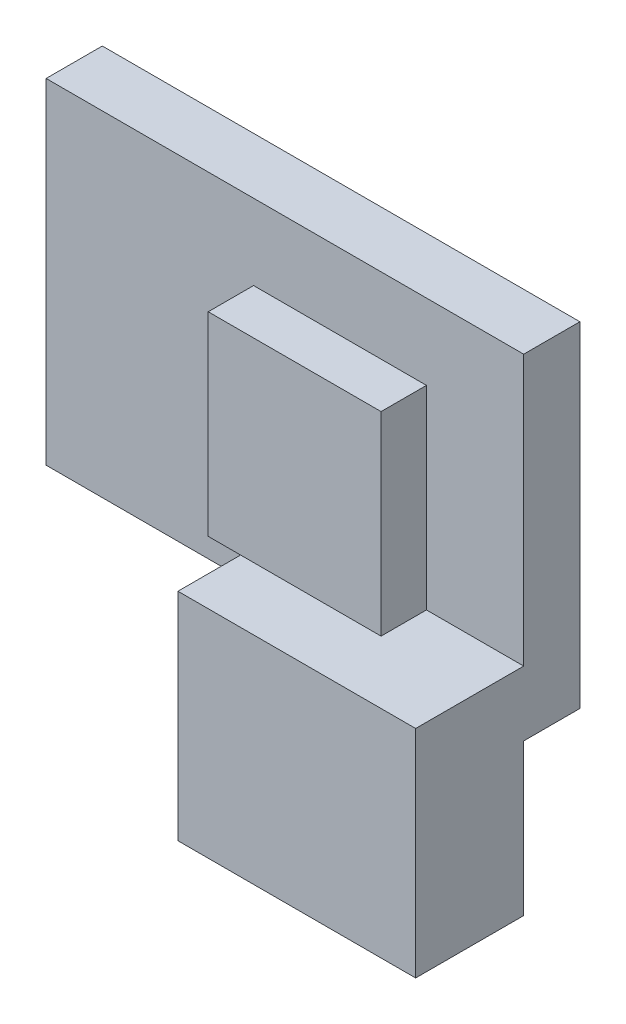
from build123d import *

# Parameters (mm, degrees)
PLACAESBOCO_W      = 22.1
PLACAESBOCO_H      = 15.5
PLACA_DEPTH        = 1.3
CONECTORESBOCO_W   = 11
CONECTORESBOCO_H   = 10
CONECTOR_DEPTH     = 5
RESISTORESESBOCO_W = 8
RESISTORESESBOCO_H = 9
RESISTORES_DEPTH   = 2.1


with BuildPart() as part:
    # PlacaEsboco → Placa (new, symmetric)
    with BuildSketch(Plane.XY):
        Rectangle(PLACAESBOCO_W, PLACAESBOCO_H)
    extrude(amount=PLACA_DEPTH, both=True)

    # ConectorEsboco → Conector (add)
    with BuildSketch(Plane.XY.offset(1.3)):
        with Locations((5.55, -9.75)):
            Rectangle(CONECTORESBOCO_W, CONECTORESBOCO_H)
    extrude(amount=CONECTOR_DEPTH)

    # ResistoresEsboco → Resistores (add)
    with BuildSketch(Plane.XY.offset(1.3)):
        with Locations((2.55, -0.25)):
            Rectangle(RESISTORESESBOCO_W, RESISTORESESBOCO_H)
    extrude(amount=RESISTORES_DEPTH)


solid = part.part
